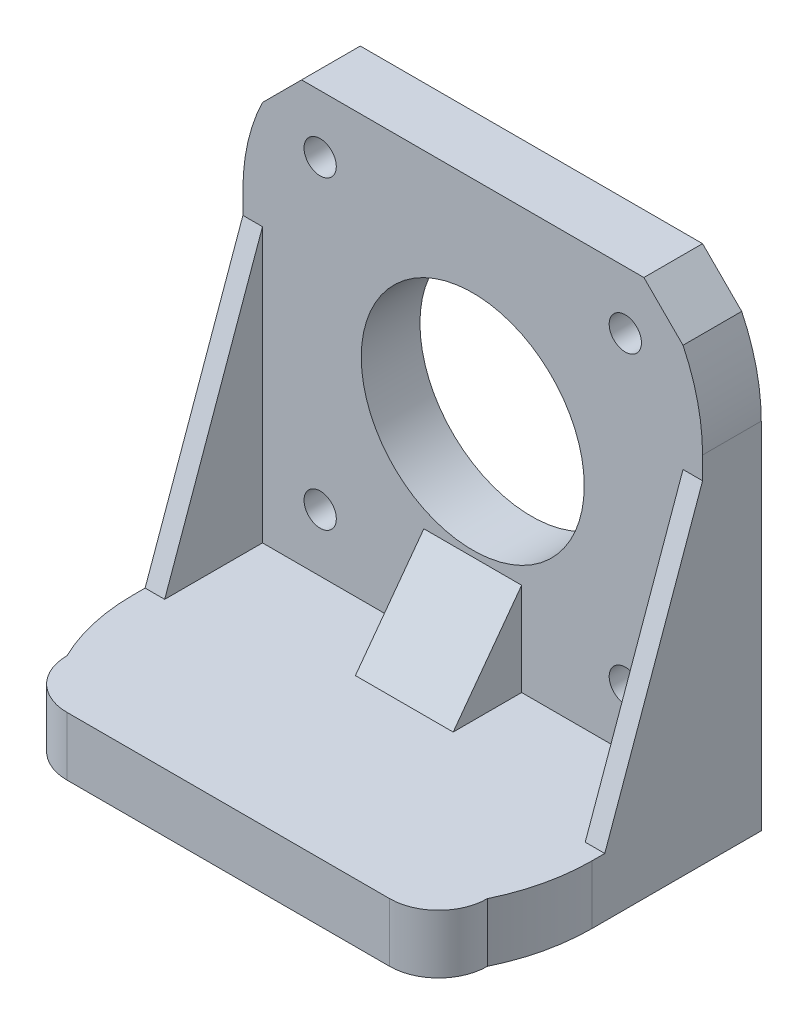
from build123d import *

# Parameters (mm, degrees)
CROQUIS1_R               = 1.65
CROQUIS1_R_2             = 11.4
SALIENTE_EXTRUIR1_DEPTH  = 6
SALIENTE_EXTRUIR2_DEPTH  = 6
NERVIO1_REACH            = 48.685
CROQUIS3_WALL_W          = 107.170654524
CROQUIS3_WALL_H          = 10
SALIENTE_EXTRUIR3_DEPTH  = 2
REDONDEO1_R              = 20
REDONDEO1_OF_SIMETR_A1_R = 20


with BuildPart() as part:
    # Croquis1 → Saliente-Extruir1 (new body)
    with BuildSketch(Plane.XY):
        Polygon((-21.5, -21.5), (21.5, -21.5), (21.5, 17.5), (17.5, 21.5), (-17.5, 21.5), (-21.5, 17.5), align=None)
        with Locations((-15.6, 15.6)):
            Circle(CROQUIS1_R, mode=Mode.SUBTRACT)
        with Locations((-15.6, -15.6)):
            Circle(CROQUIS1_R, mode=Mode.SUBTRACT)
        with Locations(Location((15.6, -15.6, 0), (0, 0, 180))):
            Circle(CROQUIS1_R, mode=Mode.SUBTRACT)
        with Locations(Location((15.6, 15.6, 0), (0, 0, 180))):
            Circle(CROQUIS1_R, mode=Mode.SUBTRACT)
        Circle(CROQUIS1_R_2, mode=Mode.SUBTRACT)
    extrude(amount=SALIENTE_EXTRUIR1_DEPTH)

    # Croquis2 → Saliente-Extruir2 (add)
    with BuildSketch(Plane.XZ.offset(21.5)):
        with BuildLine():
            Line((-21.5, 0), (21.5, 0))
            Line((21.5, 0), (21.5, 26))
            ThreePointArc((21.5, 26), (20.035533906, 29.535533906), (16.5, 31))
            Line((16.5, 31), (-16.5, 31))
            ThreePointArc((-16.5, 31), (-20.035533906, 29.535533906), (-21.5, 26))
            Line((-21.5, 26), (-21.5, 0))
        make_face()
    extrude(amount=SALIENTE_EXTRUIR2_DEPTH)

    # Croquis3 wall → Nervio1 (add, up to next)
    with BuildSketch(Plane(origin=(0, -16.75, 9.5), x_dir=(0, -0.805055837353, 0.59319903805), z_dir=(0, -0.59319903805, -0.805055837353)), mode=Mode.PRIVATE) as nervio1_sk1:
        Rectangle(CROQUIS3_WALL_W, CROQUIS3_WALL_H)
    nervio1_tool1 = extrude(nervio1_sk1.sketch, amount=NERVIO1_REACH, mode=Mode.PRIVATE) - part.part
    add(nervio1_tool1.solids().sort_by_distance((0, -16.75, 9.5))[0])

    # Croquis4 → Saliente-Extruir3 (add)
    with BuildSketch(Plane(origin=(21.5, 0, 0), x_dir=(0, 0, -1), z_dir=(1, 0, 0))):
        Polygon((-6, -21.5), (-6, 6.5), (-16, -21.5), align=None)
        Polygon((-26, -27.5), (0, -27.5), (0, 17.5), (-6, 17.5), (-6, -21.5), (-26, -21.5), align=None)
    saliente_extruir3 = extrude(amount=SALIENTE_EXTRUIR3_DEPTH)

    # Redondeo1
    # the kernel refuses this fillet: 20 mm, written as the material it takes off along each edge
    with BuildSketch(Plane(origin=(23.5, 17.5, -21.794494718), x_dir=(0, -1, 0), z_dir=(0, 0, 1)), Plane(origin=(23.5, 0.294494718, 26), x_dir=(0, 0, -1), z_dir=(0, -1, 0))) as redondeo1_piece_1:
        with BuildLine():
            CenterArc((8.717797887, -20), REDONDEO1_R, 90, 25.841932763)
            Line((0, -2), (-0.174355958, -1.64))
            ThreePointArc((-0.174355958, -1.64), (-0.4, -1), (-0.4, 0))
            Line((-0.4, 0), (0, 0.4))
            Line((0, 0.4), (8.717797887, 0.4))
            Line((8.717797887, 0.4), (8.717797887, 0))
        make_face()
    extrude(amount=49.588989435, mode=Mode.SUBTRACT)

    # Simetría1: Saliente-Extruir3 across plane
    add(saliente_extruir3.mirror(Plane(origin=(0, 0, 0), x_dir=(0, 0, 1), z_dir=(1, 0, 0))))

    # Redondeo1 of Simetría1
    # the kernel refuses this fillet: 20 mm, written as the material it takes off along each edge
    with BuildSketch(Plane(origin=(-23.5, 17.5, -21.794494718), x_dir=(0, -1, 0), z_dir=(0, 0, 1))) as redondeo1_of_simetr_a1_piece_1:
        with BuildLine():
            CenterArc((8.717797887, 20), REDONDEO1_OF_SIMETR_A1_R, 244.158067237, 25.841932763)
            Line((0, 2), (-0.174355958, 1.64))
            ThreePointArc((-0.174355958, 1.64), (-0.4, 1), (-0.4, 0))
            Line((-0.4, 0), (0, -0.4))
            Line((0, -0.4), (8.717797887, -0.4))
            Line((8.717797887, -0.4), (8.717797887, 0))
        make_face()
    extrude(amount=49.588989435, mode=Mode.SUBTRACT)
    with BuildSketch(Plane(origin=(-23.5, 0.294494718, 26), x_dir=(1, 0, 0), z_dir=(0, -1, 0))) as redondeo1_of_simetr_a1_piece_2:
        with BuildLine():
            CenterArc((20, -8.717797887), REDONDEO1_OF_SIMETR_A1_R, 154.158067237, 25.841932763)
            Line((0, -8.717797887), (-0.4, -8.717797887))
            Line((-0.4, -8.717797887), (-0.4, 0))
            Line((-0.4, 0), (0, 0.4))
            ThreePointArc((0, 0.4), (1, 0.4), (1.64, 0.174355958))
            Line((1.64, 0.174355958), (2, 0))
        make_face()
    extrude(amount=49.588989435, mode=Mode.SUBTRACT)


solid = part.part
